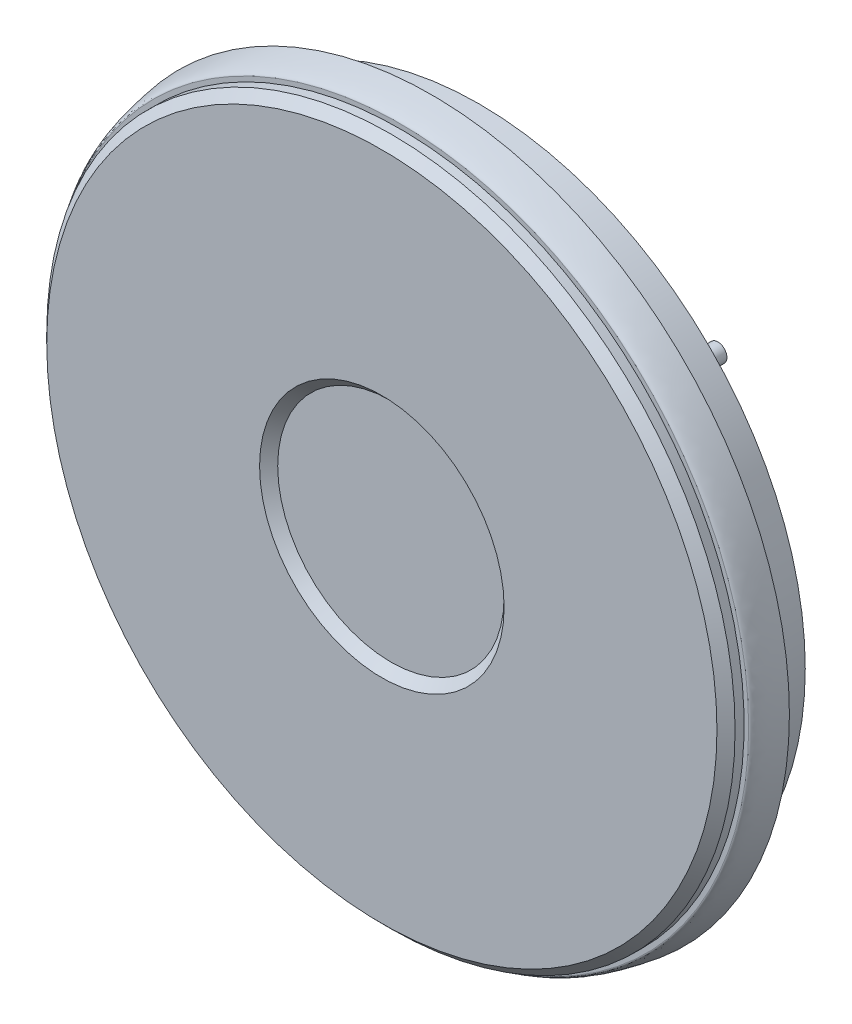
from build123d import *

# Parameters (mm, degrees)
SKETCH1_R           = 76
BOSS_EXTRUDE1_DEPTH = 4
CHAMFER1_SIZE       = 2
SKETCH2_R           = 25
CUT_EXTRUDE1_DEPTH  = 2
CHAMFER2_SIZE       = 2
SKETCH6_R           = 2
BOSS_EXTRUDE2_DEPTH = 34


with BuildPart() as part:
    # Sketch1 → Boss-Extrude1 (new body)
    with BuildSketch(Plane.XY):
        Circle(SKETCH1_R)
    extrude(amount=BOSS_EXTRUDE1_DEPTH)

    # Chamfer1
    chamfer1_edges = [part.edges().sort_by_distance(p)[0] for p in [
        (-76, 0, 4),
    ]]
    chamfer(chamfer1_edges, length=CHAMFER1_SIZE)

    # Sketch2 → Cut-Extrude1 (cut)
    with BuildSketch(Plane.XY.offset(4)):
        Circle(SKETCH2_R)
    extrude(amount=-CUT_EXTRUDE1_DEPTH, mode=Mode.SUBTRACT)

    # Chamfer2
    chamfer2_edges = [part.edges().sort_by_distance(p)[0] for p in [
        (-25, 0, 4),
    ]]
    chamfer(chamfer2_edges, length=CHAMFER2_SIZE - 0.0001)  # a hair under: the kernel refuses the full size

    # Sketch3 → Revolve1 (revolve)
    with BuildSketch(Plane(origin=(0, 0, 0), x_dir=(1, 0, 0), z_dir=(0, 1, 0)), mode=Mode.PRIVATE) as revolve1_sk:
        with BuildLine():
            Line((0, 0), (0, 19))
            Line((0, 19), (-32, 19))
            Line((-32, 19), (-50.5, 15.5))
            Line((-50.5, 15.5), (-57.5, 10))
            Line((-57.5, 10), (-69.5, 10))
            Line((-69.5, 10), (-69.5, 17.5))
            Line((-69.5, 17.5), (-72, 17.5))
            Line((-72, 17.5), (-72, 7))
            Line((-72, 7), (-79, 7))
            add(Edge.make_bspline(
                [(-79, 7), (-77.938493586, 0), (-77, 0)],
                knots=[0, 0, 0, 1, 1, 1], degree=2))
            Line((-77, 0), (0, 0))
        make_face()
    revolve(revolve1_sk.sketch.rotate(Axis((0, 0, 0), (0, 0, -1)), 180), axis=Axis((0, 0, 0), (0, 0, -1)))

    # Sketch5 → Revolve2 (revolve)
    with BuildSketch(Plane(origin=(0, 0, 0), x_dir=(1, 0, 0), z_dir=(0, 1, 0))):
        Polygon((0, 19), (-5.5, 19), (-5.5, 23), (-3, 23), (-3, 51), (0, 51), align=None)
    revolve(axis=Axis((0, 0, -51), (0, 0, 1)))

    # Sketch6 → Boss-Extrude2 (add)
    with BuildSketch(Plane(origin=(0, 0, -7), x_dir=(-1, 0, 0), z_dir=(0, 0, -1))):
        with Locations(Location((-29.2, 27.3378858, 0), (0, 0, 180))):
            Circle(SKETCH6_R)
        with Locations(Location((29.2, 27.3378858, 0), (0, 0, 180))):
            Circle(SKETCH6_R)
    extrude(amount=BOSS_EXTRUDE2_DEPTH)


solid = part.part
